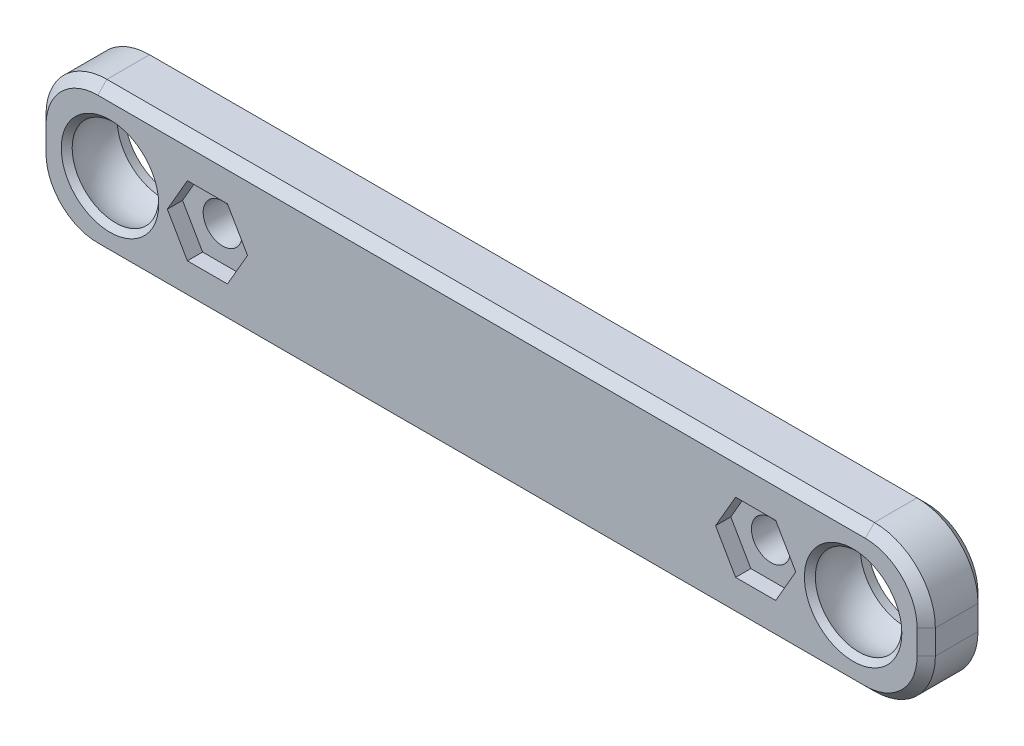
from build123d import *
from build123d.topology import SkipClean

# Parameters (mm, degrees)
SKETCH1_W                                           = 73
SKETCH1_H                                           = 12
SKETCH1_R                                           = 2.5
BOSS_EXTRUDE1_DEPTH                                 = 2.5
FILLET1_R                                           = 5
CHAMFER1_SIZE                                       = 0.75
CHAMFER1_SIZE_2                                     = 0.534818385
CSK_FOR_M3_COUNTERSUNK_FLAT_HEAD_SCREW1_D           = 3.2
CSK_FOR_M3_COUNTERSUNK_FLAT_HEAD_SCREW1_CSINK_D     = 6.3
CSK_FOR_M3_COUNTERSUNK_FLAT_HEAD_SCREW1_CSINK_ANGLE = 90
CUT_EXTRUDE1_DEPTH                                  = 1.25


with BuildPart() as part:
    # Sketch1 → Boss-Extrude1 (new, symmetric)
    with BuildSketch(Plane.XY):
        Rectangle(SKETCH1_W, SKETCH1_H)
        with Locations((-30.5, 0)):
            Circle(SKETCH1_R, mode=Mode.SUBTRACT)
        with Locations((30.5, 0)):
            Circle(SKETCH1_R, mode=Mode.SUBTRACT)
    extrude(amount=BOSS_EXTRUDE1_DEPTH, both=True)

    # Sketch2 → Cut-Revolve1 (revolve, cut)
    with SkipClean():  # the faces are left unmerged after this step: merging them gives an invalid solid
        with BuildSketch(Plane(origin=(0, 0, 0), x_dir=(1, 0, 0), z_dir=(0, 1, 0)), mode=Mode.PRIVATE) as cut_revolve1_sk:
            with BuildLine():
                ThreePointArc((-30.5, 4.1), (-34.6, 0), (-30.5, -4.1))
                Line((-30.5, -4.1), (-30.5, 4.1))
            make_face()
            with BuildLine():
                Line((-30.5, 4.1), (-30.5, -4.1))
                ThreePointArc((-30.5, -4.1), (-27.600862197, -2.899137803), (-26.4, 0))
                ThreePointArc((-26.4, 0), (-27.600862197, 2.899137803), (-30.5, 4.1))
            make_face()
        cut_revolve1 = revolve(cut_revolve1_sk.sketch.rotate(Axis((-30.5, 0, 14.750329737), (0, 0, -1)), 180), axis=Axis((-30.5, 0, 14.750329737), (0, 0, -1)), mode=Mode.SUBTRACT)
    add(part.part.scale(1), mode=Mode.REPLACE)  # the faces are merged on a copy

    # Mirror1: Cut-Revolve1 across plane
    add(cut_revolve1.mirror(Plane(origin=(0, 0, 0), x_dir=(0, 0, 1), z_dir=(1, 0, 0))), mode=Mode.SUBTRACT)

    # Fillet1
    fillet1_edges = [part.edges().sort_by_distance(p)[0] for p in [
        (36.5, -6, 0),
        (-36.5, -6, 0),
        (-36.5, 6, 0),
        (36.5, 6, 0),
    ]]
    fillet(fillet1_edges, radius=FILLET1_R)

    # Chamfer1
    # the kernel refuses this chamfer: 0.75, 0.534818385 mm, written as the material it takes off along each edge
    with BuildSketch(Plane(origin=(-30.5, 0, 2.5), x_dir=(1, 0, 0), z_dir=(0, -1, 0))) as chamfer1_piece_1:
        with BuildLine():
            Line((3.249615362 + CHAMFER1_SIZE, 0), (3.550305573, -0.449309789))
            ThreePointArc((3.550305573, -0.449309789), (3.409004663, -0.222130994), (3.249615362, 0))
            Line((3.249615362, 0), (3.249615362 + CHAMFER1_SIZE, 0))
        make_face()
    revolve(axis=Axis((-30.5, 0, 2.5), (0, 0, 1)), mode=Mode.SUBTRACT)
    with BuildSketch(Plane(origin=(30.5, 0, 2.5), x_dir=(-1, 0, 0), z_dir=(0, 1, 0))) as chamfer1_piece_2:
        with BuildLine():
            Line((3.249615362 + CHAMFER1_SIZE, 0), (3.550305573, -0.449309789))
            ThreePointArc((3.550305573, -0.449309789), (3.409004663, -0.222130994), (3.249615362, 0))
            Line((3.249615362, 0), (3.249615362 + CHAMFER1_SIZE, 0))
        make_face()
    revolve(axis=Axis((30.5, 0, 2.5), (0, 0, 1)), mode=Mode.SUBTRACT)
    with BuildSketch(Plane(origin=(-30.5, 0, -2.5), x_dir=(1, 0, 0), z_dir=(0, -1, 0))) as chamfer1_piece_3:
        with BuildLine():
            Line((3.249615362 + CHAMFER1_SIZE_2, 0), (3.691177382, 0.715284467))
            ThreePointArc((3.691177382, 0.715284467), (3.494921898, 0.356283384), (3.249615362, 0))
            Line((3.249615362, 0), (3.249615362 + CHAMFER1_SIZE_2, 0))
        make_face()
    revolve(axis=Axis((-30.5, 0, -2.5), (0, 0, 1)), mode=Mode.SUBTRACT)
    with BuildSketch(Plane(origin=(30.5, 0, -2.5), x_dir=(-1, 0, 0), z_dir=(0, 1, 0))) as chamfer1_piece_4:
        with BuildLine():
            Line((3.249615362 + CHAMFER1_SIZE_2, 0), (3.691177382, 0.715284467))
            ThreePointArc((3.691177382, 0.715284467), (3.494921898, 0.356283384), (3.249615362, 0))
            Line((3.249615362, 0), (3.249615362 + CHAMFER1_SIZE_2, 0))
        make_face()
    revolve(axis=Axis((30.5, 0, -2.5), (0, 0, 1)), mode=Mode.SUBTRACT)
    with BuildSketch(Plane(origin=(-31.5, 6, -2.5), x_dir=(0, 0, 1), z_dir=(1, 0, 0)), Plane(origin=(31.5, -6, 2.5), x_dir=(0, 1, 0), z_dir=(-1, 0, 0))) as chamfer1_piece_5:
        Polygon((CHAMFER1_SIZE, 0), (0, CHAMFER1_SIZE), (0, 0), align=None)
    extrude(amount=63, mode=Mode.SUBTRACT)
    with BuildSketch(Plane(origin=(-31.5, 6, 2.5), x_dir=(0, 0, -1), z_dir=(1, 0, 0)), Plane(origin=(31.5, -6, -2.5), x_dir=(0, 1, 0), z_dir=(-1, 0, 0))) as chamfer1_piece_6:
        Polygon((CHAMFER1_SIZE, 0), (0, -CHAMFER1_SIZE), (0, 0), align=None)
    extrude(amount=63, mode=Mode.SUBTRACT)
    with BuildSketch(Plane(origin=(36.5, 1, -2.5), x_dir=(-1, 0, 0), z_dir=(0, -1, 0)), Plane(origin=(-36.5, -1, -2.5), x_dir=(1, 0, 0), z_dir=(0, 1, 0))) as chamfer1_piece_7:
        Polygon((CHAMFER1_SIZE, 0), (0, -CHAMFER1_SIZE), (0, 0), align=None)
    extrude(amount=2, mode=Mode.SUBTRACT)
    with BuildSketch(Plane(origin=(-31.5, -1, -2.5), x_dir=(-1, 0, 0), z_dir=(0, 1, 0))) as chamfer1_piece_8:
        Polygon((5 - CHAMFER1_SIZE, 0), (5, CHAMFER1_SIZE), (5, 0), align=None)
    revolve(axis=Axis((-31.5, -1, -2.5), (0, 0, 1)), revolution_arc=90, mode=Mode.SUBTRACT)
    with BuildSketch(Plane(origin=(-31.5, 1, -2.5), x_dir=(0, 1, 0), z_dir=(1, 0, 0))) as chamfer1_piece_9:
        Polygon((5 - CHAMFER1_SIZE, 0), (5, CHAMFER1_SIZE), (5, 0), align=None)
    revolve(axis=Axis((-31.5, 1, -2.5), (0, 0, 1)), revolution_arc=90, mode=Mode.SUBTRACT)
    with BuildSketch(Plane(origin=(31.5, -1, -2.5), x_dir=(1, 0, 0), z_dir=(0, 1, 0))) as chamfer1_piece_10:
        Polygon((5 - CHAMFER1_SIZE, 0), (5, -CHAMFER1_SIZE), (5, 0), align=None)
    revolve(axis=Axis((31.5, -1, -2.5), (0, 0, -1)), revolution_arc=90, mode=Mode.SUBTRACT)
    with BuildSketch(Plane(origin=(31.5, 1, -2.5), x_dir=(0, 1, 0), z_dir=(-1, 0, 0))) as chamfer1_piece_11:
        Polygon((5 - CHAMFER1_SIZE, 0), (5, -CHAMFER1_SIZE), (5, 0), align=None)
    revolve(axis=Axis((31.5, 1, -2.5), (0, 0, -1)), revolution_arc=90, mode=Mode.SUBTRACT)
    with BuildSketch(Plane(origin=(36.5, 1, 2.5), x_dir=(-1, 0, 0), z_dir=(0, -1, 0)), Plane(origin=(-36.5, -1, 2.5), x_dir=(1, 0, 0), z_dir=(0, 1, 0))) as chamfer1_piece_12:
        Polygon((CHAMFER1_SIZE, 0), (0, CHAMFER1_SIZE), (0, 0), align=None)
    extrude(amount=2, mode=Mode.SUBTRACT)
    with BuildSketch(Plane(origin=(-31.5, -1, 2.5), x_dir=(-1, 0, 0), z_dir=(0, 1, 0))) as chamfer1_piece_13:
        Polygon((5 - CHAMFER1_SIZE, 0), (5, -CHAMFER1_SIZE), (5, 0), align=None)
    revolve(axis=Axis((-31.5, -1, 2.5), (0, 0, 1)), revolution_arc=90, mode=Mode.SUBTRACT)
    with BuildSketch(Plane(origin=(-31.5, 1, 2.5), x_dir=(0, 1, 0), z_dir=(1, 0, 0))) as chamfer1_piece_14:
        Polygon((5, -CHAMFER1_SIZE), (5 - CHAMFER1_SIZE, 0), (5, 0), align=None)
    revolve(axis=Axis((-31.5, 1, 2.5), (0, 0, 1)), revolution_arc=90, mode=Mode.SUBTRACT)
    with BuildSketch(Plane(origin=(31.5, -1, 2.5), x_dir=(1, 0, 0), z_dir=(0, 1, 0))) as chamfer1_piece_15:
        Polygon((5 - CHAMFER1_SIZE, 0), (5, CHAMFER1_SIZE), (5, 0), align=None)
    revolve(axis=Axis((31.5, -1, 2.5), (0, 0, -1)), revolution_arc=90, mode=Mode.SUBTRACT)
    with BuildSketch(Plane(origin=(31.5, 1, 2.5), x_dir=(0, 1, 0), z_dir=(-1, 0, 0))) as chamfer1_piece_16:
        Polygon((5, CHAMFER1_SIZE), (5 - CHAMFER1_SIZE, 0), (5, 0), align=None)
    revolve(axis=Axis((31.5, 1, 2.5), (0, 0, -1)), revolution_arc=90, mode=Mode.SUBTRACT)

    # CSK for M3 Countersunk Flat Head Screw1 (through all)
    with Locations(Plane(origin=(0, 0, -2.5), x_dir=(-1, 0, 0), z_dir=(0, 0, -1))):
        with Locations((-22.5, 0), (22.5, 0)):
            CounterSinkHole(CSK_FOR_M3_COUNTERSUNK_FLAT_HEAD_SCREW1_D / 2, CSK_FOR_M3_COUNTERSUNK_FLAT_HEAD_SCREW1_CSINK_D / 2, counter_sink_angle=CSK_FOR_M3_COUNTERSUNK_FLAT_HEAD_SCREW1_CSINK_ANGLE)

    # Sketch6 → Cut-Extrude1 (cut)
    with BuildSketch(Plane.XY.offset(2.5)):
        Polygon((-19.209103466, 0), (-20.854551733, 2.85), (-24.145448267, 2.85), (-25.790896534, 0), (-24.145448267, -2.85), (-20.854551733, -2.85), align=None)
        Polygon((19.209103466, 0), (20.854551733, -2.85), (24.145448267, -2.85), (25.790896534, 0), (24.145448267, 2.85), (20.854551733, 2.85), align=None)
    extrude(amount=-CUT_EXTRUDE1_DEPTH, mode=Mode.SUBTRACT)


solid = part.part
